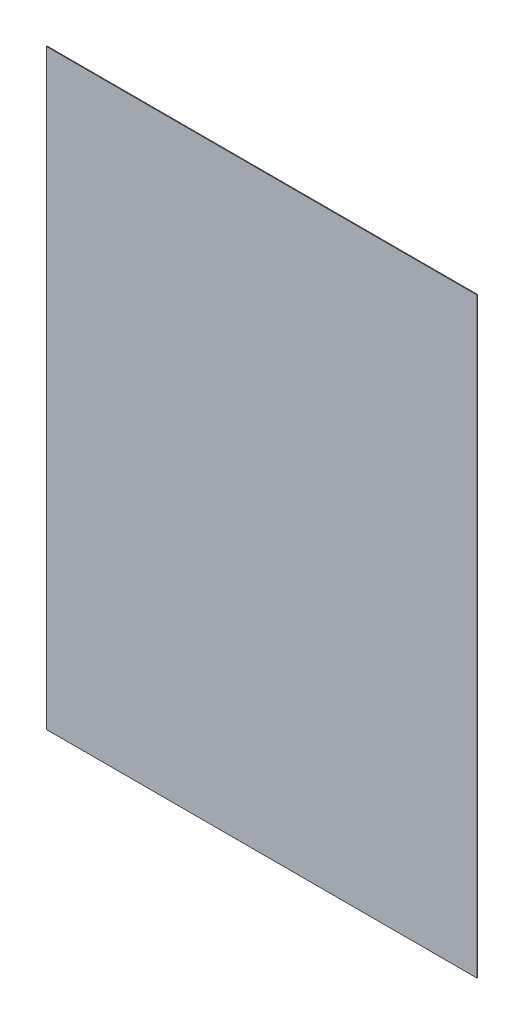
from build123d import *

# Parameters (mm, degrees)
SKETCH1_W           = 1215
SKETCH1_H           = 1670
BOSS_EXTRUDE1_DEPTH = 2


with BuildPart() as part:
    # Sketch1 → Boss-Extrude1 (new body)
    with BuildSketch(Plane.XY):
        with Locations((607.5, 835)):
            Rectangle(SKETCH1_W, SKETCH1_H)
    extrude(amount=BOSS_EXTRUDE1_DEPTH)


solid = part.part
